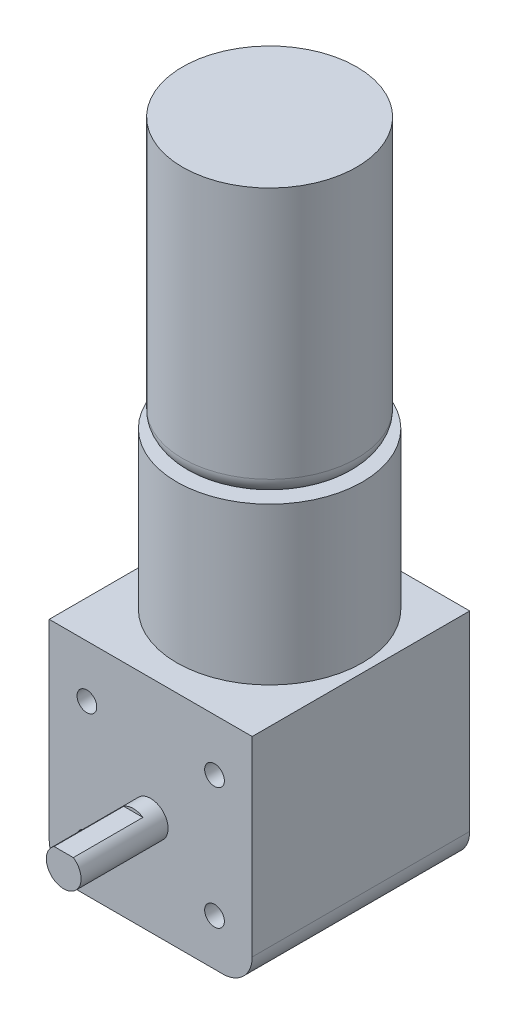
from build123d import *

# Parameters (mm, degrees)
SKETCH1_W                = 35
SKETCH1_H                = 37.5
BOSS_EXTRUDE1_DEPTH      = 38
SKETCH2_R                = 16
BOSS_EXTRUDE2_DEPTH      = 27
SKETCH3_R                = 15
BOSS_EXTRUDE3_DEPTH      = 46.5
SKETCH8_R                = 3
BOSS_EXTRUDE4_DEPTH      = 15
M3_CLEARANCE_HOLE1_D     = 3.4
M3_CLEARANCE_HOLE1_DEPTH = 12.7
M3_CLEARANCE_HOLE1_TIP   = 1.021463052
FILLET1_R                = 5.08
SKETCH12_W               = 5.08
SKETCH12_H               = 0.5
CUT_EXTRUDE1_DEPTH       = 12


with BuildPart() as part:
    # Sketch1 → Boss-Extrude1 (new body)
    with BuildSketch(Plane(origin=(0, 0, 0), x_dir=(1, 0, 0), z_dir=(0, 1, 0))):
        Rectangle(SKETCH1_W, SKETCH1_H)
    extrude(amount=-BOSS_EXTRUDE1_DEPTH)

    # Sketch2 → Boss-Extrude2 (add)
    with BuildSketch(Plane(origin=(0, 0, 0), x_dir=(1, 0, 0), z_dir=(0, 1, 0))):
        with Locations((0, 1.75)):
            Circle(SKETCH2_R)
    extrude(amount=BOSS_EXTRUDE2_DEPTH)

    # Sketch3 → Boss-Extrude3 (add)
    with BuildSketch(Plane(origin=(0, 27, 0), x_dir=(1, 0, 0), z_dir=(0, 1, 0))):
        with Locations((0, 1.75)):
            Circle(SKETCH3_R)
    extrude(amount=BOSS_EXTRUDE3_DEPTH)

    # Sketch7 → Cut-Revolve2 (revolve, cut)
    with BuildSketch(Plane(origin=(0, 0, 0), x_dir=(0, 0, -1), z_dir=(1, 0, 0))):
        with BuildLine():
            Line((13.75, 27), (16.75, 27))
            Line((16.75, 27), (16.75, 30))
            ThreePointArc((16.75, 30), (15.871320344, 27.878679656), (13.75, 27))
        make_face()
    revolve(axis=Axis((0, 73.5, -1.75), (0, -1, 0)), mode=Mode.SUBTRACT)

    # Sketch8 → Boss-Extrude4 (add)
    with BuildSketch(Plane.XY.offset(18.75)):
        with Locations((0, -21)):
            Circle(SKETCH8_R)
    extrude(amount=BOSS_EXTRUDE4_DEPTH)

    # M3 Clearance Hole1
    with Locations(Plane.XY.offset(18.75)):
        with Locations((-11, -9), (11, -9), (11, -30), (-11, -30)):
            Hole(M3_CLEARANCE_HOLE1_D / 2, depth=M3_CLEARANCE_HOLE1_DEPTH)
            with Locations((0, 0, -(M3_CLEARANCE_HOLE1_DEPTH + M3_CLEARANCE_HOLE1_TIP / 2))):  # 118° drill point
                Cone(0, M3_CLEARANCE_HOLE1_D / 2, M3_CLEARANCE_HOLE1_TIP, mode=Mode.SUBTRACT)

    # Fillet1
    fillet1_edges = [part.edges().sort_by_distance(p)[0] for p in [
        (-17.5, -38, 0),
        (17.5, -38, 0),
    ]]
    fillet(fillet1_edges, radius=FILLET1_R)

    # Sketch12 → Cut-Extrude1 (cut)
    with BuildSketch(Plane.XY.offset(33.75)):
        with Locations((0, -18.25)):
            Rectangle(SKETCH12_W, SKETCH12_H)
    extrude(amount=-CUT_EXTRUDE1_DEPTH, mode=Mode.SUBTRACT)


solid = part.part
